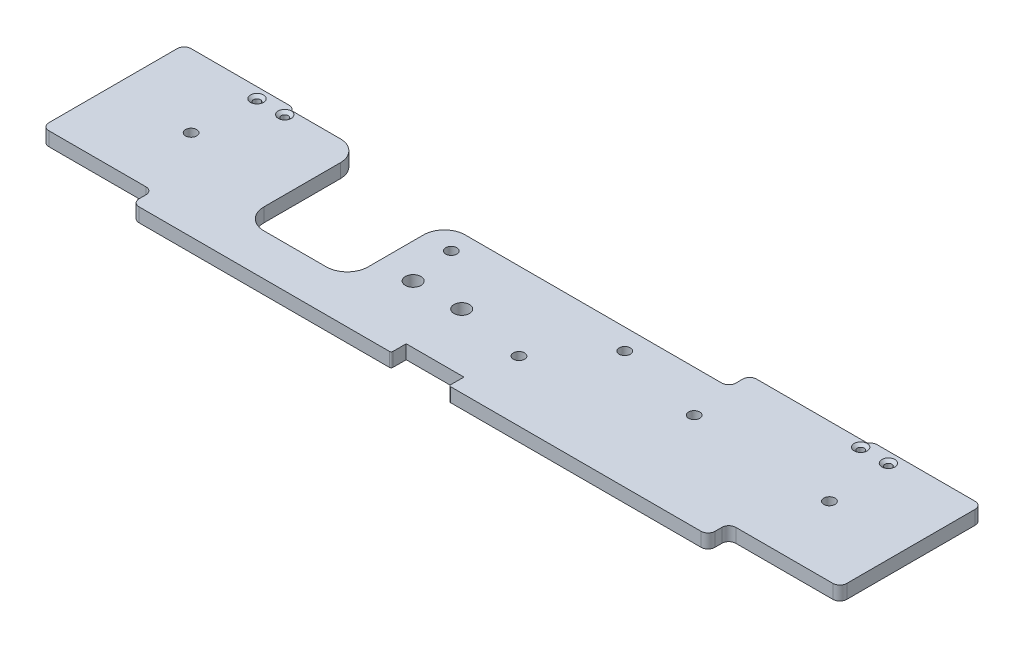
from build123d import *

# Parameters (mm, degrees)
SKETCH1_W                             = 73.025
SKETCH1_H                             = 6.35
EXTRUDE1_DEPTH                        = 182.5752
CUT_EXTRUDE1_DEPTH                    = 187.298654883
F_1_4_20_TAPPED_HOLE1_D               = 5.1054
F_1_8_0_125_DIAMETER_HOLE3_AT_2_COUNT = 2
F_1_8_0_125_DIAMETER_HOLE3_AT_2_PITCH = 12.7
F_1_8_0_125_DIAMETER_HOLE3_AT_3_COUNT = 2
F_1_8_0_125_DIAMETER_HOLE3_AT_3_PITCH = 276.2504
F_1_8_0_125_DIAMETER_HOLE3_AT_4_COUNT = 2
F_1_8_0_125_DIAMETER_HOLE3_AT_4_PITCH = 263.5504
CUT_EXTRUDE2_REACH                    = 188.299
SKETCH8_W                             = 50.8
SKETCH8_H                             = 9.525
CUT_EXTRUDE3_REACH                    = 188.299
SKETCH14_W                            = 50.8
SKETCH14_H                            = 1.5875
BOSS_EXTRUDE1_DEPTH                   = 6.35
FILLET1_R                             = 3.175
CUT_EXTRUDE4_REACH                    = 188.616
SKETCH18_W                            = 26.416
SKETCH18_H                            = 6.858
FILLET2_R                             = 0.79375
FILLET3_R                             = 9.525
F_9_32_0_28125_DIAMETER_HOLE2_D       = 7.14375
F_1_4_20_START                        = -4
F_1_4_20_TAPPED_HOLE2_OUTLINE_R       = 2.5527
F_1_4_20_TAPPED_HOLE2_DEPTH           = 8


with BuildPart() as part:
    # Sketch1 → Extrude1 (new, symmetric)
    with BuildSketch(Plane(origin=(0, 0, 0), x_dir=(0, 0, -1), z_dir=(1, 0, 0))):
        Rectangle(SKETCH1_W, SKETCH1_H)
    extrude(amount=EXTRUDE1_DEPTH, both=True)

    # Sketch2 → Cut-Extrude1 (cut, through all)
    with BuildSketch(Plane(origin=(0, 3.175, 0), x_dir=(-1, 0, 0), z_dir=(0, 1, 0))):
        with BuildLine():
            Line((100.01885, 7.9375), (100.01885, -36.5125))
            Line((100.01885, -36.5125), (52.39385, -36.5125))
            Line((52.39385, -36.5125), (52.39385, 7.9375))
            ThreePointArc((52.39385, 7.9375), (55.183657909, 14.672692091), (61.91885, 17.4625))
            Line((61.91885, 17.4625), (90.49385, 17.4625))
            ThreePointArc((90.49385, 17.4625), (97.229042091, 14.672692091), (100.01885, 7.9375))
        make_face()
    extrude(amount=-CUT_EXTRUDE1_DEPTH, mode=Mode.SUBTRACT)

    # 1/4-20 Tapped Hole1 (through all)
    with Locations(Plane(origin=(0, 3.175, 0), x_dir=(-1, 0, 0), z_dir=(0, 1, 0))):
        with Locations((146.05, -4.7625), (-17.4752, 8.73125), (-80.9752, -7.9375), (-146.05, -4.7625)):
            Hole(F_1_4_20_TAPPED_HOLE1_D / 2)

    # Sketch5 → 1/8 (0.125) Diameter Hole3 (revolve, cut)
    with BuildSketch(Plane(origin=(131.7752, 3.175, -33.3375), x_dir=(0, 0, 1), z_dir=(1, 0, 0))):
        Polygon((0, 0), (0, 6.35), (2.9765625, 6.35), (1.5875, 5.184438169), (1.5875, 1.165561831), (2.9765625, 0), align=None)
    f_1_8_0_125_diameter_hole3 = revolve(axis=Axis((131.7752, 9.525, -33.3375), (0, -1, 0)), mode=Mode.SUBTRACT)

    # 1/8 (0.125) Diameter Hole3 at 2: 1/8 (0.125) Diameter Hole3 ×2
    with Locations(*[(i * F_1_8_0_125_DIAMETER_HOLE3_AT_2_PITCH, 0, 0) for i in range(1, F_1_8_0_125_DIAMETER_HOLE3_AT_2_COUNT)]):
        add(f_1_8_0_125_diameter_hole3, mode=Mode.SUBTRACT)

    # 1/8 (0.125) Diameter Hole3 at 3: 1/8 (0.125) Diameter Hole3 ×2
    with Locations(*[(-i * F_1_8_0_125_DIAMETER_HOLE3_AT_3_PITCH, 0, 0) for i in range(1, F_1_8_0_125_DIAMETER_HOLE3_AT_3_COUNT)]):
        add(f_1_8_0_125_diameter_hole3, mode=Mode.SUBTRACT)

    # 1/8 (0.125) Diameter Hole3 at 4: 1/8 (0.125) Diameter Hole3 ×2
    with Locations(*[(-i * F_1_8_0_125_DIAMETER_HOLE3_AT_4_PITCH, 0, 0) for i in range(1, F_1_8_0_125_DIAMETER_HOLE3_AT_4_COUNT)]):
        add(f_1_8_0_125_diameter_hole3, mode=Mode.SUBTRACT)

    # Sketch8 → Cut-Extrude2 (cut, up to next)
    with BuildSketch(Plane(origin=(0, 3.175, 0), x_dir=(1, 0, 0), z_dir=(0, 1, 0)), mode=Mode.PRIVATE) as cut_extrude2_sk1:
        with Locations((-157.1752, -31.75)):
            Rectangle(SKETCH8_W, SKETCH8_H)
    cut_extrude2_tool1 = extrude(cut_extrude2_sk1.sketch, amount=-CUT_EXTRUDE2_REACH, mode=Mode.PRIVATE) & part.part
    # Sketch8 → Cut-Extrude2 (cut, up to next)
    with BuildSketch(Plane(origin=(0, 3.175, 0), x_dir=(1, 0, 0), z_dir=(0, 1, 0)), mode=Mode.PRIVATE) as cut_extrude2_sk2:
        with Locations((157.1752, -31.75)):
            Rectangle(SKETCH8_W, SKETCH8_H)
    cut_extrude2_tool2 = extrude(cut_extrude2_sk2.sketch, amount=-CUT_EXTRUDE2_REACH, mode=Mode.PRIVATE) & part.part
    add(cut_extrude2_tool1.solids().sort_by_distance((-157.1752, 3.175, 31.75))[0], mode=Mode.SUBTRACT)
    add(cut_extrude2_tool2.solids().sort_by_distance((157.1752, 3.175, 31.75))[0], mode=Mode.SUBTRACT)

    # Sketch13 → Cut-Extrude3 (cut, up to next)
    with BuildSketch(Plane(origin=(0, 3.175, 0), x_dir=(1, 0, 0), z_dir=(0, 1, 0)), mode=Mode.PRIVATE) as cut_extrude3_sk1:
        with BuildLine():
            Line((-52.39385, 36.5125), (77.8002, 36.5125))
            Line((77.8002, 36.5125), (77.8002, 30.1625))
            ThreePointArc((77.8002, 30.1625), (76.87026403, 27.91743597), (74.6252, 26.9875))
            Line((74.6252, 26.9875), (-52.39385, 26.9875))
            Line((-52.39385, 26.9875), (-52.39385, 36.5125))
        make_face()
    cut_extrude3_tool1 = extrude(cut_extrude3_sk1.sketch, amount=-CUT_EXTRUDE3_REACH, mode=Mode.PRIVATE) & part.part
    add(cut_extrude3_tool1.solids().sort_by_distance((12.590656, 3.175, -31.757083))[0], mode=Mode.SUBTRACT)

    # Sketch14 → Boss-Extrude1 (add)
    with BuildSketch(Plane(origin=(0, 3.175, 0), x_dir=(1, 0, 0), z_dir=(0, 1, 0))):
        with Locations((157.1752, 37.30625)):
            Rectangle(SKETCH14_W, SKETCH14_H)
        with Locations((-157.1752, 37.30625)):
            Rectangle(SKETCH14_W, SKETCH14_H)
    extrude(amount=-BOSS_EXTRUDE1_DEPTH)

    # Fillet1
    # the kernel refuses this fillet: 3.175 mm, written as the material it adds along each edge
    with BuildSketch(Plane(origin=(131.7752, 3.175, 26.9875), x_dir=(0, 0, 1), z_dir=(0, -1, 0)), Plane(origin=(-131.7752, 3.175, 26.9875), x_dir=(-1, 0, 0), z_dir=(0, -1, 0))) as fillet1_piece_1:
        with BuildLine():
            CenterArc((FILLET1_R, -FILLET1_R), FILLET1_R, 90, 90)
            Line((0, -FILLET1_R), (0, 0))
            Line((0, 0), (FILLET1_R, 0))
        make_face()
    extrude(amount=6.35)
    # the kernel refuses this fillet: 3.175 mm, written as the material it takes off along each edge
    with BuildSketch(Plane(origin=(182.5752, 11.1125, 26.9875), x_dir=(0, 0, -1), z_dir=(0, -1, 0)), Plane(origin=(77.8002, 11.1125, -36.5125), x_dir=(0, 0, 1), z_dir=(0, -1, 0)), Plane(origin=(182.5752, 11.1125, -38.1), x_dir=(-1, 0, 0), z_dir=(0, -1, 0)), Plane(origin=(-182.5752, 11.1125, -38.1), x_dir=(0, 0, 1), z_dir=(0, -1, 0)), Plane(origin=(-182.5752, 11.1125, 26.9875), x_dir=(1, 0, 0), z_dir=(0, -1, 0)), Plane(origin=(-131.7752, 11.1125, 36.5125), x_dir=(1, 0, 0), z_dir=(0, -1, 0))) as fillet1_2_piece_1:
        with BuildLine():
            CenterArc((FILLET1_R, -FILLET1_R), FILLET1_R, 90, 90)
            Line((0, -FILLET1_R), (0, 0))
            Line((0, 0), (FILLET1_R, 0))
        make_face()
    extrude(amount=22.225, mode=Mode.SUBTRACT)
    with BuildSketch(Plane(origin=(131.7752, 11.1125, 36.5125), x_dir=(-1, 0, 0), z_dir=(0, -1, 0))) as fillet1_2_piece_2:
        with BuildLine():
            CenterArc((FILLET1_R, FILLET1_R), FILLET1_R, 180, 90)
            Line((0, FILLET1_R), (0, 0))
            Line((0, 0), (FILLET1_R, 0))
        make_face()
    extrude(amount=22.225, mode=Mode.SUBTRACT)
    with BuildSketch(Plane(origin=(131.7752, 10.049076643, -38.1), x_dir=(0, 0, 1), z_dir=(0, -1, 0))) as fillet1_2_piece_3:
        with BuildLine():
            CenterArc((3.175, -2.749630657), FILLET1_R, 120, 60)
            Line((0, -2.749630657), (0, 0))
            Line((0, 0), (1.5875, 0))
        make_face()
    extrude(amount=20.098153285, mode=Mode.SUBTRACT)
    with BuildSketch(Plane(origin=(-131.7752, 10.049076643, -38.1), x_dir=(-1, 0, 0), z_dir=(0, -1, 0))) as fillet1_2_piece_4:
        with BuildLine():
            CenterArc((2.749630657, -3.175), FILLET1_R, 90, 60)
            Line((0, -1.5875), (0, 0))
            Line((0, 0), (2.749630657, 0))
        make_face()
    extrude(amount=20.098153285, mode=Mode.SUBTRACT)

    # Sketch18 → Cut-Extrude4 (cut, up to next)
    with BuildSketch(Plane(origin=(0, 3.175, 0), x_dir=(1, 0, 0), z_dir=(0, 1, 0)), mode=Mode.PRIVATE) as cut_extrude4_sk1:
        with Locations((0, -33.0835)):
            Rectangle(SKETCH18_W, SKETCH18_H)
    cut_extrude4_tool1 = extrude(cut_extrude4_sk1.sketch, amount=-CUT_EXTRUDE4_REACH, mode=Mode.PRIVATE) & part.part
    add(cut_extrude4_tool1.solids().sort_by_distance((0, 3.175, 33.0835))[0], mode=Mode.SUBTRACT)

    # Fillet2
    fillet2_edges = [part.edges().sort_by_distance(p)[0] for p in [
        (13.208, 0, 36.5125),
        (-13.208, 0, 36.5125),
    ]]
    fillet(fillet2_edges, radius=FILLET2_R)

    # Fillet3
    fillet3_edges = [part.edges().sort_by_distance(p)[0] for p in [
        (-52.39385, 0, -26.9875),
        (-100.01885, 0, -36.5125),
    ]]
    fillet(fillet3_edges, radius=FILLET3_R)

    # 9/32 (0.28125) Diameter Hole2 (through all)
    with Locations(Plane(origin=(0, 3.175, 0), x_dir=(1, 0, 0), z_dir=(0, 1, 0))):
        with Locations((-36.4998, -3.175), (-14.2748, -3.175)):
            Hole(F_9_32_0_28125_DIAMETER_HOLE2_D / 2)

    # 1/4-20 Tapped Hole2: read off the stored shape, not the designer's step
    # 1/4-20 Tapped Hole2 outline → 1/4-20 Tapped Hole2 (cut)
    with BuildSketch(Plane(origin=(0, 0, 0), x_dir=(1, 0, 0), z_dir=(0, 1, 0)).offset(F_1_4_20_START)):
        with Locations((-39.6875, 17.4625)):
            Circle(F_1_4_20_TAPPED_HOLE2_OUTLINE_R)
        with Locations((39.6875, 17.4625)):
            Circle(F_1_4_20_TAPPED_HOLE2_OUTLINE_R)
    extrude(amount=F_1_4_20_TAPPED_HOLE2_DEPTH, mode=Mode.SUBTRACT)


solid = part.part
